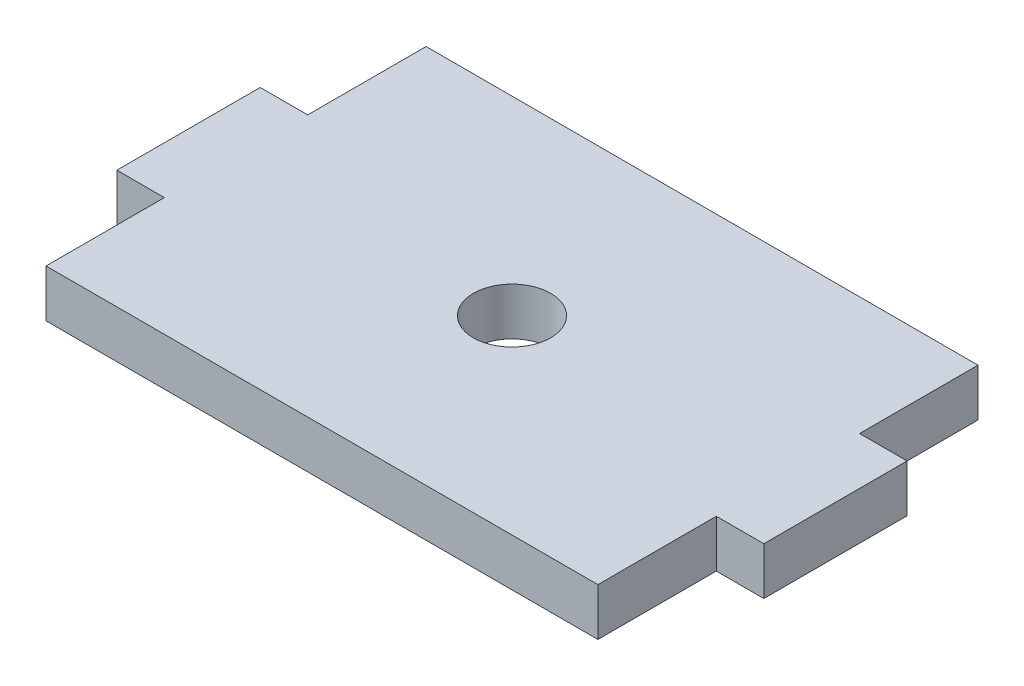
from build123d import *

# Parameters (mm, degrees)
SKETCH1_R           = 2.5796875
BOSS_EXTRUDE1_DEPTH = 1.5875


with BuildPart() as part:
    # Sketch1 → Boss-Extrude1 (new, symmetric)
    with BuildSketch(Plane(origin=(0, 0, 0), x_dir=(1, 0, 0), z_dir=(0, 1, 0))):
        Polygon((-21.6154, -4.7879), (-18.4404, -4.7879), (-18.4404, -12.7), (18.4404, -12.7), (18.4404, -4.7879), (21.6154, -4.7879), (21.6154, 4.7879), (18.4404, 4.7879), (18.4404, 12.7), (-18.4404, 12.7), (-18.4404, 4.7879), (-21.6154, 4.7879), align=None)
        Circle(SKETCH1_R, mode=Mode.SUBTRACT)
    extrude(amount=BOSS_EXTRUDE1_DEPTH, both=True)


solid = part.part
